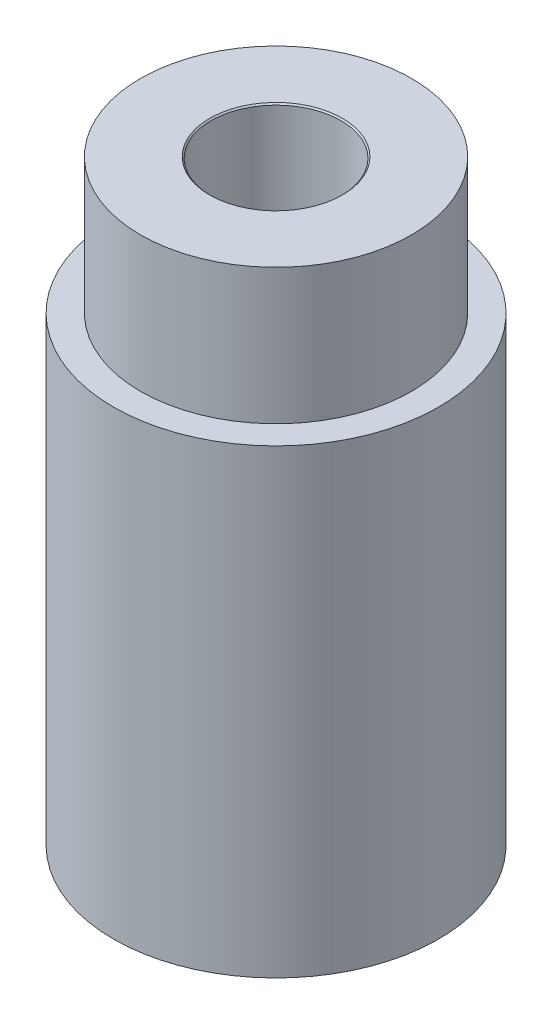
from build123d import *

# Parameters (mm, degrees)
SKETCH1_R                      = 3
BOSS_EXTRUDE1_DEPTH            = 8.5
SKETCH2_R                      = 2.5
BOSS_EXTRUDE2_DEPTH            = 2.5
M2_CLEARANCE_HOLE1_D           = 2.4
M2_CLEARANCE_HOLE1_CSINK_D     = 2.45
M2_CLEARANCE_HOLE1_CSINK_ANGLE = 90


with BuildPart() as part:
    # Sketch1 → Boss-Extrude1 (new body)
    with BuildSketch(Plane(origin=(0, 0, 0), x_dir=(1, 0, 0), z_dir=(0, 1, 0))):
        Circle(SKETCH1_R)
    extrude(amount=BOSS_EXTRUDE1_DEPTH)

    # Sketch2 → Boss-Extrude2 (add)
    with BuildSketch(Plane(origin=(0, 8.5, 0), x_dir=(1, 0, 0), z_dir=(0, 1, 0))):
        Circle(SKETCH2_R)
    extrude(amount=BOSS_EXTRUDE2_DEPTH)

    # M2 Clearance Hole1 (through all)
    with Locations(Plane(origin=(0, 11, 0), x_dir=(1, 0, 0), z_dir=(0, 1, 0))):
        with Locations((0, 0)):
            CounterSinkHole(M2_CLEARANCE_HOLE1_D / 2, M2_CLEARANCE_HOLE1_CSINK_D / 2, counter_sink_angle=M2_CLEARANCE_HOLE1_CSINK_ANGLE)


solid = part.part
